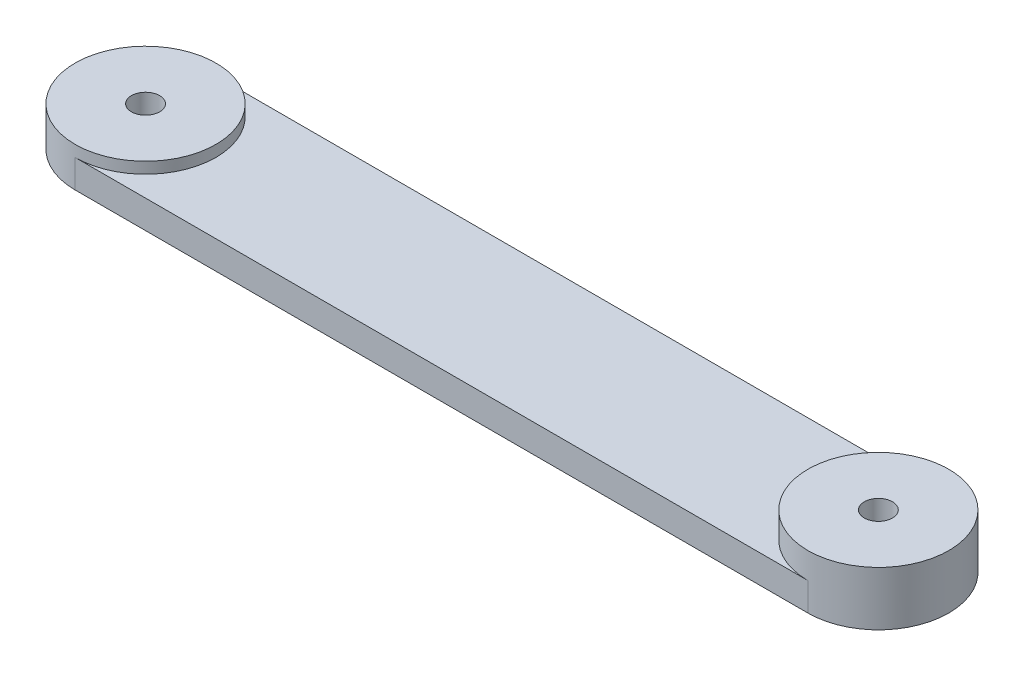
from build123d import *
from build123d.topology import SkipClean

# Parameters (mm, degrees)
EXTRUDE_1_DEPTH     = 5
SKETCH_5_R          = 12.5
EXTRUDE_2_DEPTH     = 2
CUT_EXTRUDE_1_REACH = 80.813
SKETCH_6_R          = 2.5
SKETCH_8_R          = 12.5
EXTRUDE_3_DEPTH     = 4.6
CUT_EXTRUDE_2_REACH = 81.086
SKETCH_7_R          = 2.5


with BuildPart() as part:
    # 草图1 → 凸台-拉伸1 (new body)
    with BuildSketch(Plane(origin=(0, 0, 0), x_dir=(1, 0, 0), z_dir=(0, 1, 0))):
        with BuildLine():
            Line((-65, 12.5), (65, 12.5))
            ThreePointArc((65, 12.5), (77.5, 0), (65, -12.5))
            Line((65, -12.5), (-65, -12.5))
            ThreePointArc((-65, -12.5), (-77.5, 0), (-65, 12.5))
        make_face()
    extrude(amount=EXTRUDE_1_DEPTH)

    # 草图5 → 凸台-拉伸2 (add)
    with BuildSketch(Plane(origin=(0, 5, 0), x_dir=(1, 0, 0), z_dir=(0, 1, 0))):
        with Locations((-65, 0)):
            Circle(SKETCH_5_R)
    extrude(amount=EXTRUDE_2_DEPTH)

    # 草图6 → 切除-拉伸1 (cut, up to next)
    with BuildSketch(Plane(origin=(0, 7, 0), x_dir=(1, 0, 0), z_dir=(0, 1, 0)), mode=Mode.PRIVATE) as cut_extrude_1_sk1:
        with Locations((-65, 0)):
            Circle(SKETCH_6_R)
    cut_extrude_1_tool1 = extrude(cut_extrude_1_sk1.sketch, amount=-CUT_EXTRUDE_1_REACH, mode=Mode.PRIVATE) & part.part
    add(cut_extrude_1_tool1.solids().sort_by_distance((-65, 7, 0))[0], mode=Mode.SUBTRACT)

    # 草图8 → 凸台-拉伸3 (add)
    with SkipClean():  # the faces are left unmerged after this step: merging them gives an invalid solid
        with BuildSketch(Plane(origin=(0, 5, 0), x_dir=(1, 0, 0), z_dir=(0, 1, 0))):
            with Locations((65, 0)):
                Circle(SKETCH_8_R)
        extrude(amount=EXTRUDE_3_DEPTH)
    add(part.part.scale(1), mode=Mode.REPLACE)  # the faces are merged on a copy

    # 草图7 → 切除-拉伸2 (cut, up to next)
    with BuildSketch(Plane(origin=(0, 9.6, 0), x_dir=(1, 0, 0), z_dir=(0, 1, 0)), mode=Mode.PRIVATE) as cut_extrude_2_sk1:
        with Locations((65, 0)):
            Circle(SKETCH_7_R)
    cut_extrude_2_tool1 = extrude(cut_extrude_2_sk1.sketch, amount=-CUT_EXTRUDE_2_REACH, mode=Mode.PRIVATE) & part.part
    add(cut_extrude_2_tool1.solids().sort_by_distance((65, 9.6, 0))[0], mode=Mode.SUBTRACT)


solid = part.part
